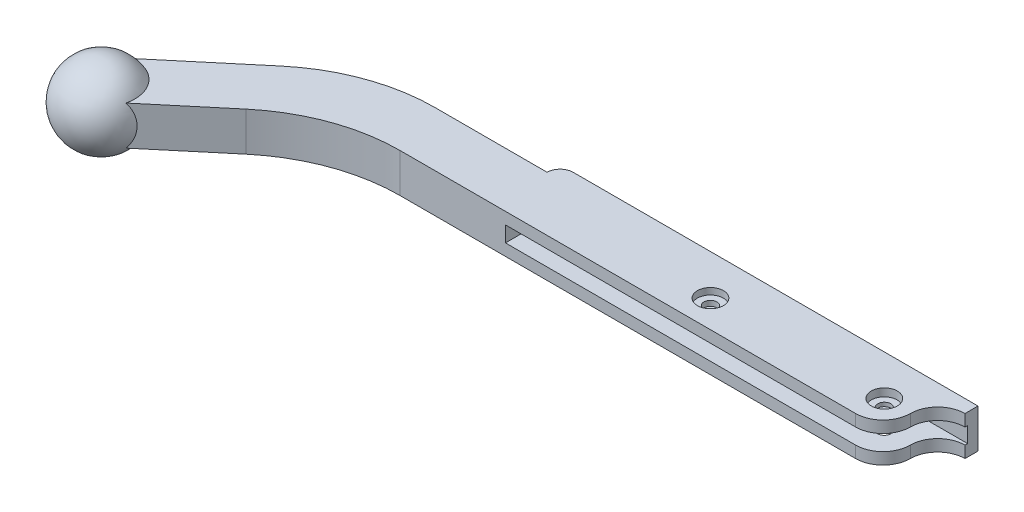
from build123d import *

# Parameters (mm, degrees)
SKETCH_1_W          = 150
SKETCH_1_H          = 21.000000000000004
EXTRUDE_1_DEPTH     = 15
CUT_EXTRUDE_1_DEPTH = 145
SKETCH_3_R          = 5.000000000000004
CUT_EXTRUDE_2_DEPTH = 3
CUT_EXTRUDE_START   = -3
SKETCH_4_R          = 5.000000000000001
CUT_EXTRUDE_3_DEPTH = 3
SKETCH_5_R          = 2.4999999999999987
CUT_EXTRUDE_4_DEPTH = 20
SKETCH_6_R          = 5.000000000000001
CUT_EXTRUDE_5_DEPTH = 20
SKETCH_7_R          = 5.999999999999998
EXTRUDE_2_DEPTH     = 2
SKETCH_8_R          = 6.000000000000003
EXTRUDE_3_DEPTH     = 2
SKETCH_9_R          = 2.500000000000002
CUT_EXTRUDE_6_DEPTH = 20
EXTRUDE_5_DEPTH     = 15
EXTRUDE_6_DEPTH     = 5
FILLET_1_R          = 5
FILLET_2_R          = 10.5
FILLET_3_R          = 67.5
SKETCH_17_W         = 22.000000000000004
SKETCH_17_H         = 5.999999999999995
CUT_EXTRUDE_7_DEPTH = 200


with BuildPart() as part:
    # 草图1 → 凸台-拉伸1 (new body)
    with BuildSketch(Plane(origin=(0, 0, 0), x_dir=(1, 0, 0), z_dir=(0, 1, 0))):
        with Locations((-32.52921535893155, 2.6552587646076753)):
            Rectangle(SKETCH_1_W, SKETCH_1_H)
    extrude(amount=EXTRUDE_1_DEPTH)

    # 草图2 → 切除-拉伸1 (cut)
    with BuildSketch(Plane(origin=(42.470784641068455, 0, 0), x_dir=(0, 0, -1), z_dir=(1, 0, 0))):
        Polygon((-7.844741235392326, 10.499999999999998), (13.155258764607675, 10.499999999999998), (13.155258764607675, 4.500000000000001), (-7.844741235392326, 4.5), align=None)
    extrude(amount=-CUT_EXTRUDE_1_DEPTH, mode=Mode.SUBTRACT)

    # 草图3 → 切除-拉伸2 (cut)
    with BuildSketch(Plane(origin=(0, 15, 0), x_dir=(1, 0, 0), z_dir=(0, 1, 0))):
        with Locations(Location((32.47078464106845, 2.655258764607675, 0), (0, 0, 270))):
            Circle(SKETCH_3_R)
    extrude(amount=-CUT_EXTRUDE_2_DEPTH, mode=Mode.SUBTRACT)

    # 草图4 → 切除-拉伸3 (cut)
    with BuildSketch(Plane(origin=(0, 0, 0), x_dir=(-1, 0, 0), z_dir=(0, -1, 0)).offset(CUT_EXTRUDE_START)):
        with Locations(Location((-32.47078464106845, 2.655258764607675, 0), (0, 0, 270))):
            Circle(SKETCH_4_R)
    extrude(amount=CUT_EXTRUDE_3_DEPTH, mode=Mode.SUBTRACT)

    # 草图5 → 切除-拉伸4 (cut)
    with BuildSketch(Plane(origin=(0, 3, 0), x_dir=(-1, 0, 0), z_dir=(0, -1, 0))):
        with Locations(Location((-32.47078464106845, 2.655258764607675, 0), (0, 0, 270))):
            Circle(SKETCH_5_R)
    extrude(amount=-CUT_EXTRUDE_4_DEPTH, mode=Mode.SUBTRACT)

    # 草图6 → 切除-拉伸5 (cut)
    with BuildSketch(Plane(origin=(0, 15, 0), x_dir=(1, 0, 0), z_dir=(0, 1, 0))):
        with Locations(Location((-34.295534758931545, 2.655258764607675, 0), (0, 0, 270))):
            Circle(SKETCH_6_R)
    extrude(amount=-CUT_EXTRUDE_5_DEPTH, mode=Mode.SUBTRACT)

    # 草图7 → 凸台-拉伸2 (add)
    with BuildSketch(Plane(origin=(0, 4.5, 1.9e-16), x_dir=(1, 0, 0), z_dir=(0, 1, 4e-17))):
        with Locations((-34.295534758931545, 2.655258764607675)):
            Circle(SKETCH_7_R)
    extrude(amount=-EXTRUDE_2_DEPTH)

    # 草图8 → 凸台-拉伸3 (add)
    with BuildSketch(Plane(origin=(0, 10.499999999999998, 0), x_dir=(-1, 0, 0), z_dir=(0, -1, 0))):
        with Locations((34.295534758931545, 2.655258764607675)):
            Circle(SKETCH_8_R)
    extrude(amount=-EXTRUDE_3_DEPTH)

    # 草图9 → 切除-拉伸6 (cut)
    with BuildSketch(Plane(origin=(0, 12.499999999999998, 0), x_dir=(1, 0, 0), z_dir=(0, 1, 0))):
        with Locations(Location((-34.295534758931545, 2.655258764607675, 0), (0, 0, 270))):
            Circle(SKETCH_9_R)
    extrude(amount=-CUT_EXTRUDE_6_DEPTH, mode=Mode.SUBTRACT)



with BuildPart() as body_2:
    # 草图12 → 凸台-拉伸5 (new body)
    with BuildSketch(Plane(origin=(0, 15, 0), x_dir=(1, 0, 0), z_dir=(0, 1, 0))):
        Polygon((-107.52921535893154, -7.844741235392326), (-167.52921535893154, -7.844741235392335), (-217.32210416166507, -49.62593586501747), (-230.82064396508238, -33.53900255951896), (-175.17259027852143, 13.155258764607666), (-107.52921535893154, 13.155258764607675), align=None)
    extrude(amount=-EXTRUDE_5_DEPTH)

    # 草图13 → 旋转3 (revolve)
    with BuildSketch(Plane(origin=(-151.96584895321814, 0, 127.51448780818791), x_dir=(0.6427876096865401, 0, 0.7660444431189775), z_dir=(-0.7660444431189775, 0, 0.6427876096865401))):
        with BuildLine():
            Line((-112.17628346215061, 22.5), (-112.17628346215061, -7.5))
            ThreePointArc((-112.17628346215061, -7.5), (-97.17628346215061, 7.5), (-112.17628346215061, 22.5))
        make_face()
    revolve(axis=Axis((-224.0713740633737, 22.5, 41.58246921226819), (0, -1, 0)))


with BuildPart() as part_1:
    add(part.part)

    add(body_2.part)  # 凸台-拉伸6 merges body 2
    # 草图14 → 凸台-拉伸6 (add)
    with BuildSketch(Plane(origin=(0, 0, -13.155258764607675), x_dir=(-1, 0, 0), z_dir=(0, 0, -1))):
        Polygon((107.52921535893154, 15), (-52.97078464106847, 14.99999999999998), (-52.97078464106847, -3.99e-14), (107.52921535893154, 0), align=None)
    extrude(amount=EXTRUDE_6_DEPTH)

    # 圆角1
    fillet_1_edges = [part_1.edges().sort_by_distance(p)[0] for p in [
        (-107.52921535893154, 7.5, -18.155258764607673),
    ]]
    fillet(fillet_1_edges, radius=FILLET_1_R - 0.0001)  # a hair under: the kernel refuses the full size

    # 圆角2
    fillet_2_edges = [part_1.edges().sort_by_distance(p)[0] for p in [
        (42.470784641068455, 12.75, -13.155258764607675),
    ]]
    fillet(fillet_2_edges, radius=FILLET_2_R - 0.0001)  # a hair under: the kernel refuses the full size
    fillet_2_2_edges = [part_1.edges().sort_by_distance(p)[0] for p in [
        (42.470784641068455, 2.2500000000000004, -13.155258764607675),
    ]]
    fillet(fillet_2_2_edges, radius=FILLET_2_R - 0.0001)  # a hair under: the kernel refuses the full size
    fillet_2_3_edges = [part_1.edges().sort_by_distance(p)[0] for p in [
        (42.470784641068455, 2.25, 7.844741235392326),
    ]]
    fillet(fillet_2_3_edges, radius=FILLET_2_R)
    fillet_2_4_edges = [part_1.edges().sort_by_distance(p)[0] for p in [
        (42.470784641068455, 12.75, 7.844741235392326),
    ]]
    fillet(fillet_2_4_edges, radius=FILLET_2_R)

    # 圆角3
    fillet_3_edges = [part_1.edges().sort_by_distance(p)[0] for p in [
        (-167.52921535893154, 7.5, 7.844741235392335),
        (-175.17259027852143, 7.5, -13.155258764607666),
    ]]
    fillet(fillet_3_edges, radius=FILLET_3_R)

    # 草图17 → 切除-拉伸7 (cut)
    with BuildSketch(Plane(origin=(-102.52921535893152, 0, 0), x_dir=(0, 0, -1), z_dir=(1, 0, 0))):
        with Locations((3.1552587646076753, 7.500000000000001)):
            Rectangle(SKETCH_17_W, SKETCH_17_H)
    extrude(amount=CUT_EXTRUDE_7_DEPTH, mode=Mode.SUBTRACT)


solid = part_1.part
